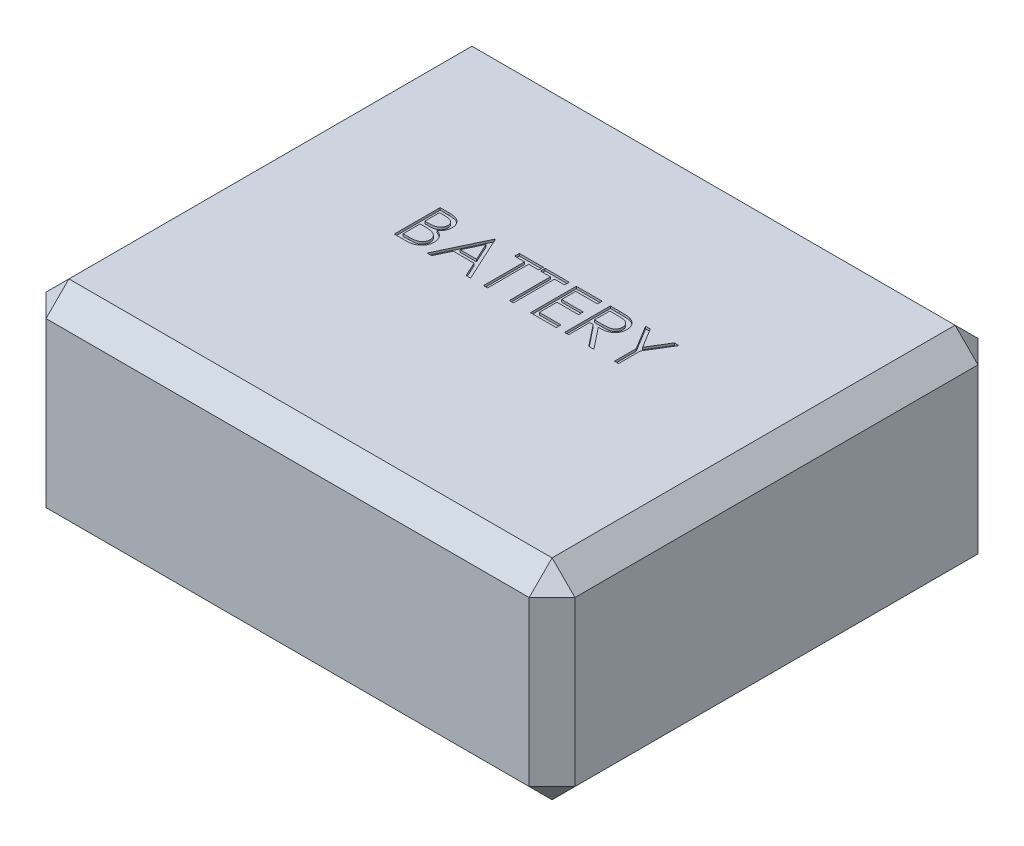
from build123d import *

# Parameters (mm, degrees)
SKETCH1_W           = 231
SKETCH1_H           = 196
BOSS_EXTRUDE1_DEPTH = 91.5
CUT_EXTRUDE1_DEPTH  = 1
CHAMFER1_SIZE       = 10


with BuildPart() as part:
    # Sketch1 → Boss-Extrude1 (new body)
    with BuildSketch(Plane(origin=(0, 0, 0), x_dir=(1, 0, 0), z_dir=(0, 1, 0))):
        with Locations((115.5, 98)):
            Rectangle(SKETCH1_W, SKETCH1_H)
    extrude(amount=BOSS_EXTRUDE1_DEPTH)

    # Sketch2 → Cut-Extrude1 (cut)
    # profile 1 of 7: a face of its own
    with BuildSketch(Plane(origin=(0, 91.5, 0), x_dir=(1, 0, 0), z_dir=(0, 1, 0))):
        with BuildLine():
            Line((64.08974359, 118), (67.991987179, 118))
            add(Edge.make_bspline(
                [(67.991987179, 118), (68.183007055, 117.998995712), (68.553251114, 117.997049152), (69.091647924, 117.966859831), (69.595926842, 117.925696003), (70.066234113, 117.860381188), (70.502352412, 117.781571033), (70.905596054, 117.686132084), (71.274682752, 117.571694292), (71.71532696, 117.389715542), (72.217730737, 117.119297437), (72.761721552, 116.719705636), (73.226888634, 116.230948704), (73.627953304, 115.679619244), (73.946816845, 115.07312912), (74.177498544, 114.425933755), (74.323543546, 113.746380945), (74.33856317, 113.279848499), (74.346153846, 113.044070513)],
                knots=[0, 0, 0, 0, 1.001505555, 1.941167018, 2.826882275, 3.653841531, 4.429895133, 5.150066043, 5.825578002, 6.45369114, 7.647487171, 8.808567382, 9.977351308, 11.170798116, 12.373658725, 13.556498008, 14.765093433, 16, 16, 16, 16], degree=3))
            add(Edge.make_bspline(
                [(74.346153846, 113.044070513), (74.339906884, 112.823198766), (74.327631013, 112.389164955), (74.210243817, 111.754341473), (74.026468569, 111.150048794), (73.771010002, 110.578492306), (73.438998595, 110.052585945), (73.045522489, 109.568087282), (72.570797903, 109.145509813), (72.215122246, 108.909264656), (72.034455128, 108.789262821)],
                knots=[0, 0, 0, 0, 1.044552857, 2.05264487, 3.044412934, 4.028983338, 5.005914585, 5.980388656, 6.974128949, 8, 8, 8, 8], degree=3))
            add(Edge.make_bspline(
                [(72.034455128, 108.789262821), (72.261657572, 108.702034255), (72.696352128, 108.535144401), (73.294557913, 108.240084607), (73.809957028, 107.919158262), (74.246512148, 107.568690547), (74.619870176, 107.190925914), (74.945886985, 106.780325261), (75.224066266, 106.331532359), (75.462425829, 105.849226443), (75.64841872, 105.338332338), (75.787709602, 104.803642189), (75.867523598, 104.247073302), (75.878881548, 103.868299705), (75.884615385, 103.677083333)],
                knots=[0, 0, 0, 0, 1.27268992, 2.434971085, 3.483601985, 4.442670788, 5.356604649, 6.2567628, 7.179492994, 8.113709626, 9.066344395, 10.018646069, 10.999752585, 12, 12, 12, 12], degree=3))
            add(Edge.make_bspline(
                [(75.884615385, 103.677083333), (75.879033407, 103.481844064), (75.868050711, 103.097705332), (75.7870223, 102.533390277), (75.649827403, 101.994104868), (75.460849424, 101.476360967), (75.214207626, 100.981160199), (74.91404783, 100.507941547), (74.556153181, 100.061459658), (74.15579393, 99.63675324), (73.702867384, 99.25488017), (73.214205927, 98.914790417), (72.683655528, 98.635098634), (72.119929848, 98.40014994), (71.516705184, 98.220680234), (70.876690285, 98.095122669), (70.200437132, 98.010522457), (69.736381411, 98.003567001), (69.498397436, 98)],
                knots=[0, 0, 0, 0, 0.978564426, 1.925352924, 2.850884081, 3.763762016, 4.682927383, 5.618979971, 6.567305752, 7.547517671, 8.540179244, 9.531824382, 10.526200242, 11.540722885, 12.589160233, 13.674978461, 14.80764778, 16, 16, 16, 16], degree=3))
            Line((69.498397436, 98), (64.08974359, 98))
            Line((64.08974359, 98), (64.08974359, 118))
        make_face()
        with BuildLine():
            Line((65.884615385, 115.948717949), (65.884615385, 109.538461538))
            Line((65.884615385, 109.538461538), (67.090544872, 109.538461538))
            add(Edge.make_bspline(
                [(67.090544872, 109.538461538), (67.266823702, 109.540746813), (67.607430327, 109.545162428), (68.100686879, 109.557811097), (68.558544125, 109.593228488), (68.980211743, 109.6286357), (69.365025708, 109.686204772), (69.712133488, 109.754731189), (70.026982614, 109.827204933), (70.390065731, 109.950459143), (70.801911151, 110.132617287), (71.24095746, 110.415313494), (71.628011572, 110.752024083), (71.954852645, 111.140543865), (72.222346762, 111.568350641), (72.40813942, 112.028618529), (72.534123901, 112.509876427), (72.545504081, 112.840266443), (72.551282051, 113.008012821)],
                knots=[0, 0, 0, 0, 1.156816544, 2.235205308, 3.236616184, 4.169592532, 5.011045266, 5.787822928, 6.49130361, 7.128639758, 8.301311294, 9.436451833, 10.541879658, 11.654887649, 12.756523258, 13.837046038, 14.901820046, 16, 16, 16, 16], degree=3))
            add(Edge.make_bspline(
                [(72.551282051, 113.008012821), (72.548275307, 113.119017229), (72.542377251, 113.336764498), (72.494072665, 113.654189379), (72.411972239, 113.952725108), (72.306519135, 114.236462881), (72.159155199, 114.496530597), (71.985649695, 114.741920286), (71.776017179, 114.964275249), (71.537403964, 115.172100954), (71.263068976, 115.356355398), (70.95317588, 115.517731188), (70.603532011, 115.647678483), (70.220029982, 115.761485069), (69.796766625, 115.841418176), (69.33862632, 115.908008963), (68.841856497, 115.941910346), (68.498170197, 115.946398134), (68.320512821, 115.948717949)],
                knots=[0, 0, 0, 0, 0.91205012, 1.789085906, 2.630437955, 3.453916878, 4.269457761, 5.079663411, 5.91843418, 6.774407191, 7.675494373, 8.627863946, 9.638891023, 10.736472738, 11.911756761, 13.175263542, 14.539845004, 16, 16, 16, 16], degree=3))
            Line((68.320512821, 115.948717949), (65.884615385, 115.948717949))
        make_face(mode=Mode.SUBTRACT)
        with BuildLine():
            Line((65.884615385, 107.487179487), (65.884615385, 100.051282051))
            Line((65.884615385, 100.051282051), (68.440705128, 100.051282051))
            add(Edge.make_bspline(
                [(68.440705128, 100.051282051), (68.623670419, 100.053474894), (68.976311897, 100.057701308), (69.485461783, 100.071498763), (69.957365233, 100.102883195), (70.389868866, 100.15228805), (70.787642881, 100.205879188), (71.14591547, 100.277943651), (71.467590861, 100.36050914), (71.840586905, 100.488132981), (72.260606953, 100.686398529), (72.713240418, 100.985336966), (73.11567595, 101.341470153), (73.457420288, 101.753646805), (73.737494509, 102.201825816), (73.941239966, 102.676942102), (74.066902005, 103.171145116), (74.082114401, 103.508097759), (74.08974359, 103.677083333)],
                knots=[0, 0, 0, 0, 1.160039823, 2.235823828, 3.228722157, 4.157150951, 4.99529583, 5.772374946, 6.472645482, 7.099169577, 8.269452708, 9.405989375, 10.527446681, 11.663510218, 12.788923519, 13.866172445, 14.929861265, 16, 16, 16, 16], degree=3))
            add(Edge.make_bspline(
                [(74.08974359, 103.677083333), (74.088165851, 103.782759565), (74.085035822, 103.992407461), (74.037832308, 104.300497856), (73.969181623, 104.598931418), (73.880430572, 104.888518506), (73.751176475, 105.164023514), (73.600281932, 105.430895283), (73.423359637, 105.689486594), (73.147678689, 106.016413756), (72.74669592, 106.393082402), (72.176942918, 106.761868129), (71.529101215, 107.059284169), (71.059229827, 107.185566891), (70.81650641, 107.250801282)],
                knots=[0, 0, 0, 0, 0.723448775, 1.435228256, 2.130040452, 2.821711965, 3.505591119, 4.210454504, 4.921174351, 5.648778258, 7.137944449, 8.670945889, 10.280296675, 12, 12, 12, 12], degree=3))
            add(Edge.make_bspline(
                [(70.81650641, 107.250801282), (70.719197291, 107.270544619), (70.508211049, 107.313352246), (70.164167732, 107.358539122), (69.771391339, 107.398796607), (69.328974897, 107.428574651), (68.836358662, 107.4593549), (68.292490556, 107.471325306), (67.699591615, 107.485606793), (67.28820663, 107.486641845), (67.074519231, 107.487179487)],
                knots=[0, 0, 0, 0, 0.634451884, 1.375622551, 2.216452059, 3.157844607, 4.20941857, 5.370758133, 6.634282058, 8, 8, 8, 8], degree=3))
            Line((67.074519231, 107.487179487), (65.884615385, 107.487179487))
        make_face(mode=Mode.SUBTRACT)
    # profile 2 of 7: a face of its own
    with BuildSketch(Plane(origin=(0, 91.5, 0), x_dir=(1, 0, 0), z_dir=(0, 1, 0))):
        Polygon((88.192307692, 118), (97.423076923, 98), (95.471955128, 98), (92.515224359, 104.41025641), (83.448717949, 104.41025641), (80.411858974, 98), (78.448717949, 98), (87.935897436, 118), align=None)
        Polygon((88.044070513, 114.09775641), (84.426282051, 106.461538462), (91.569711538, 106.461538462), align=None, mode=Mode.SUBTRACT)
    # profile 3 of 7: a face of its own
    with BuildSketch(Plane(origin=(0, 91.5, 0), x_dir=(1, 0, 0), z_dir=(0, 1, 0))):
        Polygon((98.705128205, 115.948717949), (98.705128205, 118), (109.217948718, 118), (109.217948718, 115.948717949), (104.858974359, 115.948717949), (104.858974359, 98), (103.064102564, 98), (103.064102564, 115.948717949), align=None)
    # profile 4 of 7: a face of its own
    with BuildSketch(Plane(origin=(0, 91.5, 0), x_dir=(1, 0, 0), z_dir=(0, 1, 0))):
        Polygon((109.987179487, 115.948717949), (109.987179487, 118), (120.5, 118), (120.5, 115.948717949), (116.141025641, 115.948717949), (116.141025641, 98), (114.346153846, 98), (114.346153846, 115.948717949), align=None)
    # profile 5 of 7: a face of its own
    with BuildSketch(Plane(origin=(0, 91.5, 0), x_dir=(1, 0, 0), z_dir=(0, 1, 0))):
        Polygon((123.576923077, 118), (134.858974359, 118), (134.858974359, 115.948717949), (125.371794872, 115.948717949), (125.371794872, 109.794871795), (134.858974359, 109.794871795), (134.858974359, 107.743589744), (125.371794872, 107.743589744), (125.371794872, 100.051282051), (134.858974359, 100.051282051), (134.858974359, 98), (123.576923077, 98), align=None)
    # profile 6 of 7: a face of its own
    with BuildSketch(Plane(origin=(0, 91.5, 0), x_dir=(1, 0, 0), z_dir=(0, 1, 0))):
        with BuildLine():
            Line((138.448717949, 118), (142.451121795, 118))
            add(Edge.make_bspline(
                [(142.451121795, 118), (142.718213958, 117.999110937), (143.231060497, 117.997403838), (143.965764899, 117.987885193), (144.633348311, 117.96060316), (145.233461678, 117.93712554), (145.766093992, 117.894314447), (146.232878511, 117.853396464), (146.631665354, 117.799832688), (146.873070218, 117.750087414), (146.982371795, 117.727564103)],
                knots=[0, 0, 0, 0, 1.410062039, 2.707475311, 3.878576406, 4.937260626, 5.877586885, 6.699081471, 7.410979367, 8, 8, 8, 8], degree=3))
            add(Edge.make_bspline(
                [(146.982371795, 117.727564103), (147.128695361, 117.691411158), (147.418221015, 117.619876508), (147.835078536, 117.468678789), (148.232303244, 117.293709506), (148.608245097, 117.088202532), (148.961021047, 116.850632363), (149.294268537, 116.585100235), (149.609499757, 116.293059059), (149.893966215, 115.967145679), (150.162189367, 115.625222766), (150.38841009, 115.255487013), (150.583418546, 114.868849713), (150.738678643, 114.461378754), (150.863695634, 114.037025772), (150.951845573, 113.591946934), (151.004709503, 113.128169933), (151.010091534, 112.811839026), (151.012820513, 112.651442308)],
                knots=[0, 0, 0, 0, 1.027469482, 2.033020251, 3.019912614, 3.986113645, 4.951240523, 5.91722682, 6.890402269, 7.87763091, 8.8651537, 9.85103654, 10.82876324, 11.815024772, 12.821070561, 13.842952187, 14.906261191, 16, 16, 16, 16], degree=3))
            add(Edge.make_bspline(
                [(151.012820513, 112.651442308), (151.004426238, 112.384955996), (150.988046833, 111.864972179), (150.835331955, 111.110338571), (150.585180414, 110.40639963), (150.240475905, 109.754041699), (149.801507473, 109.165980869), (149.273937238, 108.649463981), (148.657470886, 108.217235909), (148.083589081, 107.917505597), (147.576650797, 107.725546119), (147.159317581, 107.590481211), (146.70407771, 107.486127124), (146.215292941, 107.392640657), (145.690929195, 107.322059546), (145.132243256, 107.27036472), (144.538836675, 107.23805587), (144.13118485, 107.233244414), (143.921474359, 107.230769231)],
                knots=[0, 0, 0, 0, 1.260483769, 2.459530307, 3.627416485, 4.787058657, 5.939039949, 7.08810263, 8.267026773, 9.491475466, 10.141966685, 10.831826277, 11.566392101, 12.351337768, 13.187381173, 14.07005841, 15.007169909, 16, 16, 16, 16], degree=3))
            Line((143.921474359, 107.230769231), (151.269230769, 98))
            Line((151.269230769, 98), (149.049679487, 98))
            Line((149.049679487, 98), (141.701923077, 107.230769231))
            Line((141.701923077, 107.230769231), (140.243589744, 107.230769231))
            Line((140.243589744, 107.230769231), (140.243589744, 98))
            Line((140.243589744, 98), (138.448717949, 98))
            Line((138.448717949, 98), (138.448717949, 118))
        make_face()
        with BuildLine():
            Line((140.243589744, 115.948717949), (140.243589744, 109.282051282))
            Line((140.243589744, 109.282051282), (143.905448718, 109.25400641))
            add(Edge.make_bspline(
                [(143.905448718, 109.25400641), (144.076420369, 109.253930772), (144.407812124, 109.253784164), (144.887244494, 109.276605743), (145.333645132, 109.302567561), (145.745306573, 109.342278107), (146.122412718, 109.39345566), (146.464775079, 109.457472713), (146.772952519, 109.532055928), (147.132372738, 109.64749379), (147.533724346, 109.830385323), (147.969904117, 110.096473887), (148.341346047, 110.431154567), (148.655162403, 110.813860031), (148.907330583, 111.234638595), (149.08511375, 111.688446419), (149.197927706, 112.163826979), (149.21123368, 112.490559024), (149.217948718, 112.655448718)],
                knots=[0, 0, 0, 0, 1.146690395, 2.22261258, 3.21895312, 4.145990853, 4.996080663, 5.770904154, 6.481378293, 7.121626537, 8.300444488, 9.431385265, 10.535395872, 11.636531494, 12.74115979, 13.810798291, 14.895190096, 16, 16, 16, 16], degree=3))
            add(Edge.make_bspline(
                [(149.217948718, 112.655448718), (149.211079455, 112.816286282), (149.197467081, 113.135007646), (149.086331261, 113.601612848), (148.898391939, 114.04199542), (148.645122008, 114.454363905), (148.336555408, 114.828682396), (147.974739336, 115.148951842), (147.569566792, 115.413234497), (147.19087423, 115.582116672), (146.852393016, 115.68565869), (146.558509244, 115.758522484), (146.226443657, 115.817062306), (145.854583894, 115.863965511), (145.444517432, 115.904279478), (144.994170854, 115.931432499), (144.50653211, 115.947511722), (144.168549646, 115.948306516), (143.993589744, 115.948717949)],
                knots=[0, 0, 0, 0, 1.101028733, 2.181837193, 3.264309656, 4.369019818, 5.486613113, 6.575447106, 7.666700264, 8.788928104, 9.402425223, 10.0903467, 10.862060571, 11.710948788, 12.657782767, 13.684531032, 14.801375019, 16, 16, 16, 16], degree=3))
            Line((143.993589744, 115.948717949), (140.243589744, 115.948717949))
        make_face(mode=Mode.SUBTRACT)
    # profile 7 of 7: a face of its own
    with BuildSketch(Plane(origin=(0, 91.5, 0), x_dir=(1, 0, 0), z_dir=(0, 1, 0))):
        Polygon((153.833333333, 118), (155.888621795, 118), (161.137019231, 109.414262821), (166.389423077, 118), (168.448717949, 118), (162.038461538, 107.507211538), (162.038461538, 98), (160.243589744, 98), (160.243589744, 107.507211538), align=None)
    extrude(amount=-CUT_EXTRUDE1_DEPTH, mode=Mode.SUBTRACT)

    # Chamfer1
    chamfer1_edges = [part.edges().sort_by_distance(p)[0] for p in [
        (0, 91.5, -98),
        (0, 0, -98),
        (115.5, 91.5, -196),
        (0, 45.75, -196),
        (115.5, 0, -196),
        (231, 91.5, -98),
        (231, 45.75, -196),
        (231, 0, -98),
        (0, 45.75, 0),
        (115.5, 91.5, 0),
        (231, 45.75, 0),
        (115.5, 0, 0),
    ]]
    chamfer(chamfer1_edges, length=CHAMFER1_SIZE)


solid = part.part
